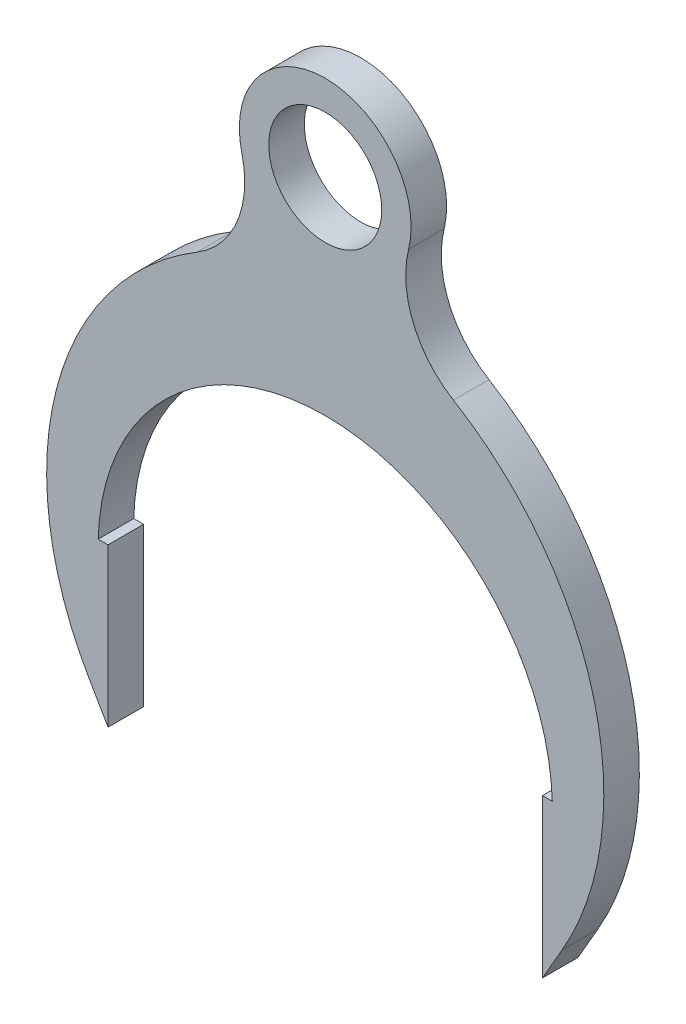
from build123d import *

# Parameters (mm, degrees)
SKETCH_1_R      = 14.3
EXTRUDE_1_DEPTH = 9


with BuildPart() as part:
    # Sketch 1 → Бобышка-Вытянуть1 (new body)
    with BuildSketch(Plane.XY):
        with BuildLine():
            Line((-55, -108.08739831), (-55, -148.08739831))
            Line((-55, -148.08739831), (-60, -139.427144273))
            ThreePointArc((-60, -139.427144273), (-68.056385746, -80.406003175), (-32.47221146, -32.633971733))
            ThreePointArc((-32.47221146, -32.633971733), (-22.286605842, -20.795527399), (-21.113695467, -5.222486356))
            ThreePointArc((-21.113695467, -5.222486356), (0, 21.75), (21.113695467, -5.222486356))
            ThreePointArc((21.113695467, -5.222486356), (22.286605842, -20.795527399), (32.47221146, -32.633971733))
            ThreePointArc((32.47221146, -32.633971733), (68.056385746, -80.406003175), (60, -139.427144273))
            Line((60, -139.427144273), (55, -148.08739831))
            Line((55, -148.08739831), (55, -108.08739831))
            Line((55, -108.08739831), (57.5, -108.08739831))
            ThreePointArc((57.5, -108.08739831), (0, -52.25), (-57.5, -108.08739831))
            Line((-57.5, -108.08739831), (-55, -108.08739831))
        make_face()
        Circle(SKETCH_1_R, mode=Mode.SUBTRACT)
    extrude(amount=EXTRUDE_1_DEPTH)


solid = part.part
